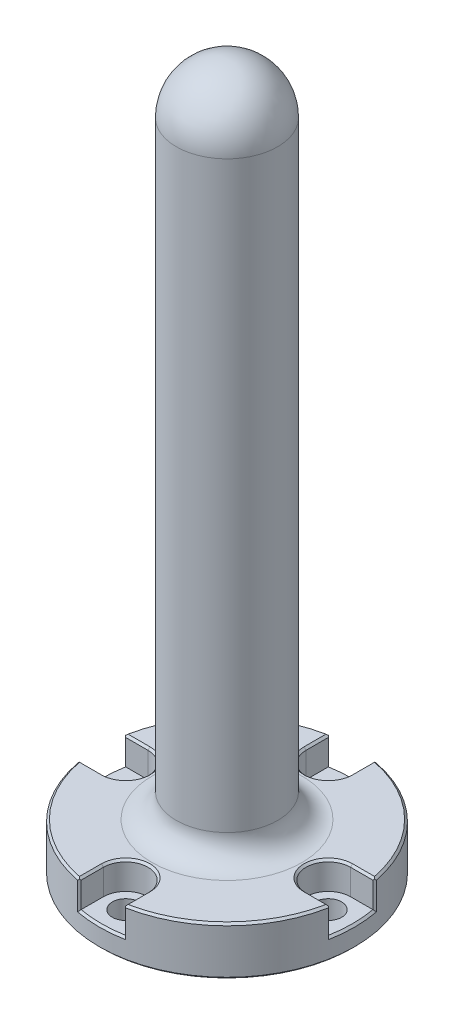
from build123d import *

# Parameters (mm, degrees)
SKETCH_1_R                = 31.5
EXTRUDE_1_DEPTH           = 12
HOLE_WIZARD_5_D           = 6.6
HOLE_WIZARD_5_CBORE_D     = 11
HOLE_WIZARD_5_CBORE_DEPTH = 6.8
PATTERN_CIRCULAR_2_COUNT  = 4
CHAMFER_2_SIZE            = 0.5
SKETCH_15_R               = 12.5
EXTRUDE_2_DEPTH           = 150
FILLET_2_R                = 6
SKETCH_18_W               = 11
SKETCH_18_H               = 10
SKETCH_18_W_2             = 10
SKETCH_18_H_2             = 11
CUT_EXTRUDE_1_DEPTH       = 6.8
CHAMFER_3_SIZE            = 0.5


with BuildPart() as part:
    # 草图1 → 凸台-拉伸1 (new body)
    with BuildSketch(Plane(origin=(0, 0, 0), x_dir=(1, 0, 0), z_dir=(0, 1, 0))):
        with Locations(Location((0, 0, 0), (0, 0, 270))):
            Circle(SKETCH_1_R)
    extrude(amount=EXTRUDE_1_DEPTH)

    # 打孔尺寸(%根据)内六角圆柱头螺钉的类型5 (through all)
    with Locations(Plane(origin=(0, 12, 0), x_dir=(1, 0, 0), z_dir=(0, 1, 0))):
        with Locations((0, 25)):
            hole_wizard_5 = CounterBoreHole(HOLE_WIZARD_5_D / 2, HOLE_WIZARD_5_CBORE_D / 2, HOLE_WIZARD_5_CBORE_DEPTH)

    # 阵列(圆周)2: 打孔尺寸(%根据)内六角圆柱头螺钉的类型5 ×4 about axis
    pattern_circular_2_axis = Axis((0, 0, 0), (0, 1, 0))
    for i in range(1, PATTERN_CIRCULAR_2_COUNT):
        add(hole_wizard_5.rotate(pattern_circular_2_axis, i * 360 / PATTERN_CIRCULAR_2_COUNT), mode=Mode.SUBTRACT)

    # 倒角2
    chamfer_2_edges = [part.edges().sort_by_distance(p)[0] for p in [
        (0, 0, -31.5),
        (0, 12, -31.5),
    ]]
    chamfer(chamfer_2_edges, length=CHAMFER_2_SIZE)

    # 草图15 → 凸台-拉伸2 (add)
    with BuildSketch(Plane(origin=(0, 12, 0), x_dir=(1, 0, 0), z_dir=(0, 1, 0))):
        with Locations(Location((0, 0, 0), (0, 0, 270))):
            Circle(SKETCH_15_R)
    extrude(amount=EXTRUDE_2_DEPTH)

    # 圆角2
    fillet_2_edges = [part.edges().sort_by_distance(p)[0] for p in [
        (0, 12, -12.5),
    ]]
    fillet(fillet_2_edges, radius=FILLET_2_R)

    # 草图17 → 旋转5 (revolve)
    with BuildSketch(Plane.XY):
        with BuildLine():
            Line((-12.5, 162), (12.5, 162))
            ThreePointArc((12.5, 162), (0, 174.5), (-12.5, 162))
        make_face()
    revolve(axis=Axis((-12.5, 162, 0), (1, 0, 0)))

    # 草图18 → 切除-拉伸1 (cut)
    with BuildSketch(Plane(origin=(0, 12, 0), x_dir=(1, 0, 0), z_dir=(0, 1, 0))):
        with Locations((0, 30)):
            Rectangle(SKETCH_18_W, SKETCH_18_H)
        with Locations((30, 0)):
            Rectangle(SKETCH_18_W_2, SKETCH_18_H_2)
        with Locations((0, -30)):
            Rectangle(SKETCH_18_W, SKETCH_18_H)
        with Locations((-30, 0)):
            Rectangle(SKETCH_18_W_2, SKETCH_18_H_2)
    extrude(amount=-CUT_EXTRUDE_1_DEPTH, mode=Mode.SUBTRACT)

    # 倒角3
    # the kernel refuses this chamfer: 0.5, 0.431316304 mm, written as the material it takes off along each edge
    with BuildSketch(Plane(origin=(0, 5.2, 0), x_dir=(-0.21464068055375052, 0, -0.9766930829341544), z_dir=(-0.9766930829341544, 0, 0.21464068055375052))) as chamfer_3_piece_1_section:
        Polygon((31.5, CHAMFER_3_SIZE), (31.5 - CHAMFER_3_SIZE, 0), (31.5, 0), align=None)
    chamfer_3_piece_1 = revolve(axis=Axis((0, 5.2, 0), (0, -1, 0)), revolution_arc=24.788895367, mode=Mode.PRIVATE)
    chamfer_3_piece_1 = split(chamfer_3_piece_1, bisect_by=Plane(origin=(-5.5, 5.2, 0), z_dir=(1, 0, 0)), keep=Keep.TOP, mode=Mode.PRIVATE)
    chamfer_3_piece_1 = split(chamfer_3_piece_1, bisect_by=Plane(origin=(5.5, 5.2, 0), z_dir=(-1, 0, 0)), keep=Keep.TOP, mode=Mode.PRIVATE)
    add(chamfer_3_piece_1, mode=Mode.SUBTRACT)
    with BuildSketch(Plane(origin=(5.5, 12, -25), x_dir=(1, 0, 0), z_dir=(0, 0, -1)), Plane(origin=(-5.5, 12, -31.794037114), x_dir=(-1, 0, 0), z_dir=(0, 0, 1)), Plane(origin=(25, 12, 5.5), x_dir=(0, 0, 1), z_dir=(1, 0, 0)), Plane(origin=(31.794037114, 12, -5.5), x_dir=(0, 0, -1), z_dir=(-1, 0, 0)), Plane(origin=(5.5, 12, 31.794037114), x_dir=(1, 0, 0), z_dir=(0, 0, -1)), Plane(origin=(-5.5, 12, 25), x_dir=(-1, 0, 0), z_dir=(0, 0, 1)), Plane(origin=(-31.794037114, 12, 5.5), x_dir=(0, 0, 1), z_dir=(1, 0, 0)), Plane(origin=(-25, 12, -5.5), x_dir=(0, 0, -1), z_dir=(-1, 0, 0))) as chamfer_3_piece_2:
        Polygon((CHAMFER_3_SIZE, 0), (0, CHAMFER_3_SIZE), (0, 0), align=None)
    extrude(amount=6.794037114, mode=Mode.SUBTRACT)
    with BuildSketch(Plane(origin=(0, 12, -25), x_dir=(-1, 0, 0), z_dir=(0, 0, -1))) as chamfer_3_piece_3:
        Polygon((5.5 + CHAMFER_3_SIZE, 0), (5.5, -CHAMFER_3_SIZE), (5.5, 0), align=None)
    revolve(axis=Axis((0, 12, -25), (0, 1, 0)), revolution_arc=180, mode=Mode.SUBTRACT)
    with BuildSketch(Plane(origin=(0, 5.2, 0), x_dir=(0.9766930829341305, 0, -0.2146406805538595), z_dir=(-0.2146406805538595, 0, -0.9766930829341305))) as chamfer_3_piece_4_section:
        Polygon((31.5, CHAMFER_3_SIZE), (31.5 - CHAMFER_3_SIZE, 0), (31.5, 0), align=None)
    chamfer_3_piece_4 = revolve(axis=Axis((0, 5.2, 0), (0, -1, 0)), revolution_arc=24.788895367, mode=Mode.PRIVATE)
    chamfer_3_piece_4 = split(chamfer_3_piece_4, bisect_by=Plane(origin=(0, 5.2, -5.5), z_dir=(0, 0, 1)), keep=Keep.TOP, mode=Mode.PRIVATE)
    chamfer_3_piece_4 = split(chamfer_3_piece_4, bisect_by=Plane(origin=(0, 5.2, 5.5), z_dir=(0, 0, -1)), keep=Keep.TOP, mode=Mode.PRIVATE)
    add(chamfer_3_piece_4, mode=Mode.SUBTRACT)
    with BuildSketch(Plane(origin=(25, 12, 0), x_dir=(0, 0, -1), z_dir=(1, 0, 0))) as chamfer_3_piece_5:
        Polygon((5.5 + CHAMFER_3_SIZE, 0), (5.5, -CHAMFER_3_SIZE), (5.5, 0), align=None)
    revolve(axis=Axis((25, 12, 0), (0, 1, 0)), revolution_arc=180, mode=Mode.SUBTRACT)
    with BuildSketch(Plane(origin=(0, 5.2, 0), x_dir=(0.21464008092789288, 0, 0.9766932147093415), z_dir=(0.9766932147093415, 0, -0.21464008092789288))) as chamfer_3_piece_6_section:
        Polygon((31.5, CHAMFER_3_SIZE), (31.5 - CHAMFER_3_SIZE, 0), (31.5, 0), align=None)
    chamfer_3_piece_6 = revolve(axis=Axis((0, 5.2, 0), (0, -1, 0)), revolution_arc=12.394412508, mode=Mode.PRIVATE)
    chamfer_3_piece_6 = split(chamfer_3_piece_6, bisect_by=Plane(origin=(5.5, 5.2, 0), z_dir=(-1, 0, 0)), keep=Keep.TOP, mode=Mode.PRIVATE)
    add(chamfer_3_piece_6, mode=Mode.SUBTRACT)
    with BuildSketch(Plane(origin=(0, 12, 25), x_dir=(1, 0, 0), z_dir=(0, 0, 1))) as chamfer_3_piece_7:
        Polygon((5.5 + CHAMFER_3_SIZE, 0), (5.5, -CHAMFER_3_SIZE), (5.5, 0), align=None)
    revolve(axis=Axis((0, 12, 25), (0, 1, 0)), revolution_arc=180, mode=Mode.SUBTRACT)
    with BuildSketch(Plane(origin=(0, 5.2, 0), x_dir=(-0.976693082934139, 0, 0.21464068055382032), z_dir=(0.21464068055382032, 0, 0.976693082934139))) as chamfer_3_piece_8_section:
        Polygon((31.5, CHAMFER_3_SIZE), (31.5 - CHAMFER_3_SIZE, 0), (31.5, 0), align=None)
    chamfer_3_piece_8 = revolve(axis=Axis((0, 5.2, 0), (0, -1, 0)), revolution_arc=24.788895367, mode=Mode.PRIVATE)
    chamfer_3_piece_8 = split(chamfer_3_piece_8, bisect_by=Plane(origin=(0, 5.2, 5.5), z_dir=(0, 0, -1)), keep=Keep.TOP, mode=Mode.PRIVATE)
    chamfer_3_piece_8 = split(chamfer_3_piece_8, bisect_by=Plane(origin=(0, 5.2, -5.5), z_dir=(0, 0, 1)), keep=Keep.TOP, mode=Mode.PRIVATE)
    add(chamfer_3_piece_8, mode=Mode.SUBTRACT)
    with BuildSketch(Plane(origin=(-25, 12, 0), x_dir=(0, 0, 1), z_dir=(-1, 0, 0))) as chamfer_3_piece_9:
        Polygon((5.5 + CHAMFER_3_SIZE, 0), (5.5, -CHAMFER_3_SIZE), (5.5, 0), align=None)
    revolve(axis=Axis((-25, 12, 0), (0, 1, 0)), revolution_arc=180, mode=Mode.SUBTRACT)
    with BuildSketch(Plane(origin=(5.5, 12.785841494, -31.016124839), x_dir=(0.9834262779301596, 0, 0.1813084550605199), z_dir=(0, -1, 0)), Plane(origin=(31.016124839, 12.785841494, 5.5), x_dir=(-0.18130845506040544, 0, 0.9834262779301808), z_dir=(0, -1, 0)), Plane(origin=(-5.5, 12.785841494, 31.016124839), x_dir=(-0.9834262779301947, 0, -0.18130845506032997), z_dir=(0, -1, 0)), Plane(origin=(-31.016124839, 12.785841494, -5.5), x_dir=(0.1813084550604473, 0, -0.9834262779301729), z_dir=(0, -1, 0))) as chamfer_3_piece_10:
        with BuildLine():
            Line((0.429282296, 0), (CHAMFER_3_SIZE * 0.181308455061, CHAMFER_3_SIZE * 0.98342627793))
            Line((CHAMFER_3_SIZE * 0.181308455061, CHAMFER_3_SIZE * 0.98342627793), (0, 0))
            ThreePointArc((0, 0), (0.220311626, -0.000730781), (0.429282296, 0))
        make_face()
    extrude(amount=7.585841494, mode=Mode.SUBTRACT)
    with BuildSketch(Plane(origin=(-5.5, 12.785841494, -31.016124839), x_dir=(-0.9834262779301588, 0, 0.18130845506052423), z_dir=(0, -1, 0)), Plane(origin=(31.016124839, 12.785841494, -5.5), x_dir=(-0.1813084550606311, 0, -0.9834262779301391), z_dir=(0, -1, 0)), Plane(origin=(5.5, 12.785841494, 31.016124839), x_dir=(0.9834262779301249, 0, -0.18130845506070803), z_dir=(0, -1, 0)), Plane(origin=(-31.016124839, 12.785841494, 5.5), x_dir=(0.18130845506059723, 0, 0.9834262779301454), z_dir=(0, -1, 0))) as chamfer_3_piece_11:
        with BuildLine():
            Line((0.429282296, 0), (CHAMFER_3_SIZE * 0.181308455061, -CHAMFER_3_SIZE * 0.98342627793))
            Line((CHAMFER_3_SIZE * 0.181308455061, -CHAMFER_3_SIZE * 0.98342627793), (0, 0))
            ThreePointArc((0, 0), (0.220311626, 0.000730781), (0.429282296, 0))
        make_face()
    extrude(amount=7.585841494, mode=Mode.SUBTRACT)
    with BuildSketch(Plane(origin=(0, 5.2, 0), x_dir=(0, 0, 1), z_dir=(1, 0, 0))) as chamfer_3_piece_12_section:
        Polygon((31.5, CHAMFER_3_SIZE), (31.5 - CHAMFER_3_SIZE, 0), (31.5, 0), align=None)
    chamfer_3_piece_12 = revolve(axis=Axis((0, 5.2, 0), (0, -1, 0)), revolution_arc=12.394412507, mode=Mode.PRIVATE)
    chamfer_3_piece_12 = split(chamfer_3_piece_12, bisect_by=Plane(origin=(-5.5, 5.2, 0), z_dir=(1, 0, 0)), keep=Keep.TOP, mode=Mode.PRIVATE)
    add(chamfer_3_piece_12, mode=Mode.SUBTRACT)
    with BuildSketch(Plane(origin=(-5.5, 12.785841494, -31.016124839), x_dir=(-0.9834262779301588, 0, 0.18130845506052423), z_dir=(0, -1, 0))) as chamfer_3_piece_13a_section:
        with BuildLine():
            Line((0.429282296, 0), (CHAMFER_3_SIZE * 0.181308455061, -CHAMFER_3_SIZE * 0.98342627793))
            Line((CHAMFER_3_SIZE * 0.181308455061, -CHAMFER_3_SIZE * 0.98342627793), (0, 0))
            ThreePointArc((0, 0), (0.220311626, 0.000730781), (0.429282296, 0))
        make_face()
    chamfer_3_piece_13a = extrude(amount=8.871682988, mode=Mode.PRIVATE)
    chamfer_3_piece_13a = split(chamfer_3_piece_13a, bisect_by=Plane(origin=(-5.5, 5.2, -31.016124839), z_dir=(0, -1, 0)), keep=Keep.TOP, mode=Mode.PRIVATE)
    with BuildSketch(Plane(origin=(0, 5.2, 0), x_dir=(-0.21464068055375052, 0, -0.9766930829341544), z_dir=(-0.9766930829341544, 0, 0.21464068055375052))) as chamfer_3_piece_13b_section:
        Polygon((31.5, CHAMFER_3_SIZE), (31.5 - CHAMFER_3_SIZE, 0), (31.5, 0), align=None)
    chamfer_3_piece_13b = revolve(axis=Axis((0, 5.2, 0), (0, -1, 0)), revolution_arc=24.788895367, mode=Mode.PRIVATE)
    chamfer_3_piece_13b = split(chamfer_3_piece_13b, bisect_by=Plane(origin=(-5.5, 5.2, 0), z_dir=(-1, 0, 0)), keep=Keep.TOP, mode=Mode.PRIVATE)
    chamfer_3_piece_13 = chamfer_3_piece_13a & chamfer_3_piece_13b
    add(chamfer_3_piece_13, mode=Mode.SUBTRACT)
    with BuildSketch(Plane(origin=(0, 5.2, 0), x_dir=(-0.21464068055375052, 0, -0.9766930829341544), z_dir=(-0.9766930829341544, 0, 0.21464068055375052))) as chamfer_3_piece_14a_section:
        Polygon((31.5, CHAMFER_3_SIZE), (31.5 - CHAMFER_3_SIZE, 0), (31.5, 0), align=None)
    chamfer_3_piece_14a = revolve(axis=Axis((0, 5.2, 0), (0, -1, 0)), revolution_arc=24.788895367, mode=Mode.PRIVATE)
    chamfer_3_piece_14a = split(chamfer_3_piece_14a, bisect_by=Plane(origin=(5.5, 5.2, 0), z_dir=(1, 0, 0)), keep=Keep.TOP, mode=Mode.PRIVATE)
    with BuildSketch(Plane(origin=(5.5, 12.785841494, -31.016124839), x_dir=(0.9834262779301596, 0, 0.1813084550605199), z_dir=(0, -1, 0))) as chamfer_3_piece_14b_section:
        with BuildLine():
            Line((0.429282296, 0), (CHAMFER_3_SIZE * 0.181308455061, CHAMFER_3_SIZE * 0.98342627793))
            Line((CHAMFER_3_SIZE * 0.181308455061, CHAMFER_3_SIZE * 0.98342627793), (0, 0))
            ThreePointArc((0, 0), (0.220311626, -0.000730781), (0.429282296, 0))
        make_face()
    chamfer_3_piece_14b = extrude(amount=8.871682988, mode=Mode.PRIVATE)
    chamfer_3_piece_14b = split(chamfer_3_piece_14b, bisect_by=Plane(origin=(5.5, 5.2, -31.016124839), z_dir=(0, -1, 0)), keep=Keep.TOP, mode=Mode.PRIVATE)
    chamfer_3_piece_14 = chamfer_3_piece_14a & chamfer_3_piece_14b
    add(chamfer_3_piece_14, mode=Mode.SUBTRACT)
    with BuildSketch(Plane(origin=(31.016124839, 12.785841494, -5.5), x_dir=(-0.1813084550606311, 0, -0.9834262779301391), z_dir=(0, -1, 0))) as chamfer_3_piece_15a_section:
        with BuildLine():
            Line((0.429282296, 0), (CHAMFER_3_SIZE * 0.181308455061, -CHAMFER_3_SIZE * 0.98342627793))
            Line((CHAMFER_3_SIZE * 0.181308455061, -CHAMFER_3_SIZE * 0.98342627793), (0, 0))
            ThreePointArc((0, 0), (0.220311626, 0.000730781), (0.429282296, 0))
        make_face()
    chamfer_3_piece_15a = extrude(amount=8.871682988, mode=Mode.PRIVATE)
    chamfer_3_piece_15a = split(chamfer_3_piece_15a, bisect_by=Plane(origin=(31.016124839, 5.2, -5.5), z_dir=(0, -1, 0)), keep=Keep.TOP, mode=Mode.PRIVATE)
    with BuildSketch(Plane(origin=(0, 5.2, 0), x_dir=(0.9766930829341305, 0, -0.2146406805538595), z_dir=(-0.2146406805538595, 0, -0.9766930829341305))) as chamfer_3_piece_15b_section:
        Polygon((31.5, CHAMFER_3_SIZE), (31.5 - CHAMFER_3_SIZE, 0), (31.5, 0), align=None)
    chamfer_3_piece_15b = revolve(axis=Axis((0, 5.2, 0), (0, -1, 0)), revolution_arc=24.788895367, mode=Mode.PRIVATE)
    chamfer_3_piece_15b = split(chamfer_3_piece_15b, bisect_by=Plane(origin=(0, 5.2, -5.5), z_dir=(0, 0, -1)), keep=Keep.TOP, mode=Mode.PRIVATE)
    chamfer_3_piece_15 = chamfer_3_piece_15a & chamfer_3_piece_15b
    add(chamfer_3_piece_15, mode=Mode.SUBTRACT)
    with BuildSketch(Plane(origin=(0, 5.2, 0), x_dir=(0.9766930829341305, 0, -0.2146406805538595), z_dir=(-0.2146406805538595, 0, -0.9766930829341305))) as chamfer_3_piece_16a_section:
        Polygon((31.5, CHAMFER_3_SIZE), (31.5 - CHAMFER_3_SIZE, 0), (31.5, 0), align=None)
    chamfer_3_piece_16a = revolve(axis=Axis((0, 5.2, 0), (0, -1, 0)), revolution_arc=24.788895367, mode=Mode.PRIVATE)
    chamfer_3_piece_16a = split(chamfer_3_piece_16a, bisect_by=Plane(origin=(0, 5.2, 5.5), z_dir=(0, 0, 1)), keep=Keep.TOP, mode=Mode.PRIVATE)
    with BuildSketch(Plane(origin=(31.016124839, 12.785841494, 5.5), x_dir=(-0.18130845506040544, 0, 0.9834262779301808), z_dir=(0, -1, 0))) as chamfer_3_piece_16b_section:
        with BuildLine():
            Line((0.429282296, 0), (CHAMFER_3_SIZE * 0.18130845506, CHAMFER_3_SIZE * 0.98342627793))
            Line((CHAMFER_3_SIZE * 0.18130845506, CHAMFER_3_SIZE * 0.98342627793), (0, 0))
            ThreePointArc((0, 0), (0.220311626, -0.000730781), (0.429282296, 0))
        make_face()
    chamfer_3_piece_16b = extrude(amount=8.871682988, mode=Mode.PRIVATE)
    chamfer_3_piece_16b = split(chamfer_3_piece_16b, bisect_by=Plane(origin=(31.016124839, 5.2, 5.5), z_dir=(0, -1, 0)), keep=Keep.TOP, mode=Mode.PRIVATE)
    chamfer_3_piece_16 = chamfer_3_piece_16a & chamfer_3_piece_16b
    add(chamfer_3_piece_16, mode=Mode.SUBTRACT)
    with BuildSketch(Plane(origin=(5.5, 12.785841494, 31.016124839), x_dir=(0.9834262779301249, 0, -0.18130845506070803), z_dir=(0, -1, 0))) as chamfer_3_piece_17a_section:
        with BuildLine():
            Line((0.429282296, 0), (CHAMFER_3_SIZE * 0.181308455061, -CHAMFER_3_SIZE * 0.98342627793))
            Line((CHAMFER_3_SIZE * 0.181308455061, -CHAMFER_3_SIZE * 0.98342627793), (0, 0))
            ThreePointArc((0, 0), (0.220311626, 0.000730781), (0.429282296, 0))
        make_face()
    chamfer_3_piece_17a = extrude(amount=8.871682988, mode=Mode.PRIVATE)
    chamfer_3_piece_17a = split(chamfer_3_piece_17a, bisect_by=Plane(origin=(5.5, 5.2, 31.016124839), z_dir=(0, -1, 0)), keep=Keep.TOP, mode=Mode.PRIVATE)
    with BuildSketch(Plane(origin=(0, 5.2, 0), x_dir=(0.21464008092789288, 0, 0.9766932147093415), z_dir=(0.9766932147093415, 0, -0.21464008092789288))) as chamfer_3_piece_17b_section:
        Polygon((31.5, CHAMFER_3_SIZE), (31.5 - CHAMFER_3_SIZE, 0), (31.5, 0), align=None)
    chamfer_3_piece_17b = revolve(axis=Axis((0, 5.2, 0), (0, -1, 0)), revolution_arc=12.394412508, mode=Mode.PRIVATE)
    chamfer_3_piece_17b = split(chamfer_3_piece_17b, bisect_by=Plane(origin=(5.5, 5.2, 0), z_dir=(1, 0, 0)), keep=Keep.TOP, mode=Mode.PRIVATE)
    chamfer_3_piece_17 = chamfer_3_piece_17a & chamfer_3_piece_17b
    add(chamfer_3_piece_17, mode=Mode.SUBTRACT)
    with BuildSketch(Plane(origin=(-31.016124839, 12.785841494, 5.5), x_dir=(0.18130845506059723, 0, 0.9834262779301454), z_dir=(0, -1, 0))) as chamfer_3_piece_18a_section:
        with BuildLine():
            Line((0.429282296, 0), (CHAMFER_3_SIZE * 0.181308455061, -CHAMFER_3_SIZE * 0.98342627793))
            Line((CHAMFER_3_SIZE * 0.181308455061, -CHAMFER_3_SIZE * 0.98342627793), (0, 0))
            ThreePointArc((0, 0), (0.220311626, 0.000730781), (0.429282296, 0))
        make_face()
    chamfer_3_piece_18a = extrude(amount=8.871682988, mode=Mode.PRIVATE)
    chamfer_3_piece_18a = split(chamfer_3_piece_18a, bisect_by=Plane(origin=(-31.016124839, 5.2, 5.5), z_dir=(0, -1, 0)), keep=Keep.TOP, mode=Mode.PRIVATE)
    with BuildSketch(Plane(origin=(0, 5.2, 0), x_dir=(-0.976693082934139, 0, 0.21464068055382032), z_dir=(0.21464068055382032, 0, 0.976693082934139))) as chamfer_3_piece_18b_section:
        Polygon((31.5, CHAMFER_3_SIZE), (31.5 - CHAMFER_3_SIZE, 0), (31.5, 0), align=None)
    chamfer_3_piece_18b = revolve(axis=Axis((0, 5.2, 0), (0, -1, 0)), revolution_arc=24.788895367, mode=Mode.PRIVATE)
    chamfer_3_piece_18b = split(chamfer_3_piece_18b, bisect_by=Plane(origin=(0, 5.2, 5.5), z_dir=(0, 0, 1)), keep=Keep.TOP, mode=Mode.PRIVATE)
    chamfer_3_piece_18 = chamfer_3_piece_18a & chamfer_3_piece_18b
    add(chamfer_3_piece_18, mode=Mode.SUBTRACT)
    with BuildSketch(Plane(origin=(0, 5.2, 0), x_dir=(-0.976693082934139, 0, 0.21464068055382032), z_dir=(0.21464068055382032, 0, 0.976693082934139))) as chamfer_3_piece_19a_section:
        Polygon((31.5, CHAMFER_3_SIZE), (31.5 - CHAMFER_3_SIZE, 0), (31.5, 0), align=None)
    chamfer_3_piece_19a = revolve(axis=Axis((0, 5.2, 0), (0, -1, 0)), revolution_arc=24.788895367, mode=Mode.PRIVATE)
    chamfer_3_piece_19a = split(chamfer_3_piece_19a, bisect_by=Plane(origin=(0, 5.2, -5.5), z_dir=(0, 0, -1)), keep=Keep.TOP, mode=Mode.PRIVATE)
    with BuildSketch(Plane(origin=(-31.016124839, 12.785841494, -5.5), x_dir=(0.1813084550604473, 0, -0.9834262779301729), z_dir=(0, -1, 0))) as chamfer_3_piece_19b_section:
        with BuildLine():
            Line((0.429282296, 0), (CHAMFER_3_SIZE * 0.18130845506, CHAMFER_3_SIZE * 0.98342627793))
            Line((CHAMFER_3_SIZE * 0.18130845506, CHAMFER_3_SIZE * 0.98342627793), (0, 0))
            ThreePointArc((0, 0), (0.220311626, -0.000730781), (0.429282296, 0))
        make_face()
    chamfer_3_piece_19b = extrude(amount=8.871682988, mode=Mode.PRIVATE)
    chamfer_3_piece_19b = split(chamfer_3_piece_19b, bisect_by=Plane(origin=(-31.016124839, 5.2, -5.5), z_dir=(0, -1, 0)), keep=Keep.TOP, mode=Mode.PRIVATE)
    chamfer_3_piece_19 = chamfer_3_piece_19a & chamfer_3_piece_19b
    add(chamfer_3_piece_19, mode=Mode.SUBTRACT)
    with BuildSketch(Plane(origin=(0, 5.2, 0), x_dir=(0, 0, 1), z_dir=(1, 0, 0))) as chamfer_3_piece_20a_section:
        Polygon((31.5, CHAMFER_3_SIZE), (31.5 - CHAMFER_3_SIZE, 0), (31.5, 0), align=None)
    chamfer_3_piece_20a = revolve(axis=Axis((0, 5.2, 0), (0, -1, 0)), revolution_arc=12.394412507, mode=Mode.PRIVATE)
    chamfer_3_piece_20a = split(chamfer_3_piece_20a, bisect_by=Plane(origin=(-5.5, 5.2, 0), z_dir=(-1, 0, 0)), keep=Keep.TOP, mode=Mode.PRIVATE)
    with BuildSketch(Plane(origin=(-5.5, 12.785841494, 31.016124839), x_dir=(-0.9834262779301947, 0, -0.18130845506032997), z_dir=(0, -1, 0))) as chamfer_3_piece_20b_section:
        with BuildLine():
            Line((0.429282296, 0), (CHAMFER_3_SIZE * 0.18130845506, CHAMFER_3_SIZE * 0.98342627793))
            Line((CHAMFER_3_SIZE * 0.18130845506, CHAMFER_3_SIZE * 0.98342627793), (0, 0))
            ThreePointArc((0, 0), (0.220311626, -0.000730781), (0.429282296, 0))
        make_face()
    chamfer_3_piece_20b = extrude(amount=8.871682988, mode=Mode.PRIVATE)
    chamfer_3_piece_20b = split(chamfer_3_piece_20b, bisect_by=Plane(origin=(-5.5, 5.2, 31.016124839), z_dir=(0, -1, 0)), keep=Keep.TOP, mode=Mode.PRIVATE)
    chamfer_3_piece_20 = chamfer_3_piece_20a & chamfer_3_piece_20b
    add(chamfer_3_piece_20, mode=Mode.SUBTRACT)


solid = part.part
